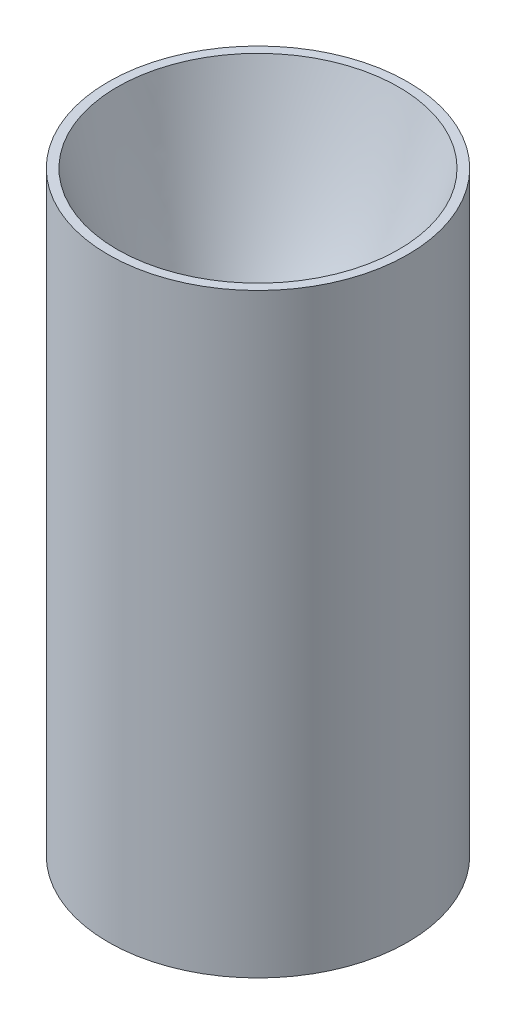
from build123d import *

# Parameters (mm, degrees)
SHORTEN_CHAMBER_75IN_BY = 19.05
CIRPATTERN1_COUNT       = 8


with BuildPart() as part:
    # Sketch1 → Revolve2 (revolve)
    with BuildSketch(Plane.XY):
        with BuildLine():
            Line((71.638455479, 109.927347077), (76.2, 109.927347077))
            Line((76.2, 109.927347077), (76.2, -212.127673725))
            Line((76.2, -212.127673725), (53.792460196, -212.127673725))
            Line((53.792460196, -212.127673725), (53.792460196, -59.727673725))
            add(Edge.make_bspline(
                [(53.792460196, -59.727673725), (53.792458964, -59.657143655), (53.791929819, -59.515566601), (53.789553965, -59.181725115), (53.783229362, -58.904955991), (53.77374387, -58.532727986), (53.761100968, -58.21299812), (53.741350135, -57.781754942), (53.711337787, -57.281120398), (53.667125616, -56.688158665), (53.588220936, -55.848640867), (53.488359334, -55.008326363), (53.367608248, -54.172595934), (53.197743271, -53.172585746), (53.002996623, -52.17760333), (52.777307543, -51.188699595), (52.520946634, -50.207649553), (52.240221737, -49.233238259), (51.935281123, -48.266129746), (51.5444702, -47.149295595), (51.050452714, -45.89056894), (50.509666089, -44.651129345), (49.922993248, -43.432862075), (49.291052535, -42.237253796), (48.615057518, -41.066315445), (47.895407794, -39.921133233), (47.134034398, -38.804236825), (46.430801308, -37.85161238), (45.804470174, -37.055832726), (45.263749909, -36.403541893), (44.82605917, -35.894408249), (44.425708405, -35.447153279), (44.092389714, -35.084791811), (43.784856831, -34.760500781), (43.58500461, -34.551710083), (43.355324273, -34.318676923), (43.254715351, -34.217322692), (43.204843203, -34.167450306)],
                knots=[0.082637729, 0.082637729, 0.082637729, 0.082637729, 0.082637729, 0.092574926, 0.102512123, 0.11244932, 0.122386517, 0.132323714, 0.142260911, 0.162135305, 0.182009699, 0.201884093, 0.24163288, 0.261507274, 0.281381668, 0.321130456, 0.360879243, 0.380753637, 0.400628031, 0.440376819, 0.480125606, 0.519874394, 0.559623181, 0.599371969, 0.639120757, 0.678869544, 0.718618332, 0.75836712, 0.798115907, 0.817990301, 0.837864695, 0.857739089, 0.877613483, 0.88755068, 0.897487877, 0.907425074, 0.91736227, 0.91736227, 0.91736227, 0.91736227, 0.91736227], degree=4))
            Line((43.204843203, -34.167450306), (34.597215006, -25.55982211))
            add(Edge.make_bspline(
                [(24.01, 0), (24.010001231, -0.070528647), (24.010530378, -0.21358419), (24.012906064, -0.543182916), (24.019230459, -0.824160397), (24.028715581, -1.194822072), (24.041357875, -1.513435058), (24.0571581, -1.861939603), (24.076113359, -2.193706872), (24.103750974, -2.6180694), (24.143219182, -3.122033947), (24.214231845, -3.879978675), (24.334058818, -4.886450388), (24.510418188, -6.05671076), (24.761817381, -7.385166414), (25.062727465, -8.703574514), (25.412702779, -10.009637208), (25.811293143, -11.301819595), (26.257877555, -12.578099333), (26.75193549, -13.836887482), (27.292605293, -15.076197126), (27.879411561, -16.294609791), (28.511071576, -17.489938791), (29.187464578, -18.661287753), (29.906377287, -19.805743392), (30.668954188, -20.92386007), (31.370099384, -21.874411755), (31.999668317, -22.673445475), (32.535060612, -23.320422132), (32.983187966, -23.84000501), (33.419382225, -24.32981624), (33.846758322, -24.788484383), (34.156490841, -25.113868303), (34.44779216, -25.409649039), (34.547344628, -25.509949925), (34.597215006, -25.55982211)],
                knots=[0.082637729, 0.082637729, 0.082637729, 0.082637729, 0.082637729, 0.092574926, 0.102512123, 0.11244932, 0.122386517, 0.132323714, 0.142260911, 0.152198108, 0.162135305, 0.182009699, 0.201884093, 0.24163288, 0.281381668, 0.321130456, 0.360879243, 0.400628031, 0.440376819, 0.480125606, 0.519874394, 0.559623181, 0.599371969, 0.639120757, 0.678869544, 0.718618332, 0.75836712, 0.798115907, 0.817990301, 0.837864695, 0.857739089, 0.877613483, 0.897487877, 0.907425074, 0.91736227, 0.91736227, 0.91736227, 0.91736227, 0.91736227], degree=4))
            add(Edge.make_bspline(
                [(24.01, 0), (24.010000626, 0.035892652), (24.010538457, 0.11011369), (24.012955849, 0.267641069), (24.019393694, 0.427064117), (24.031465725, 0.646764266), (24.052367213, 0.901433328), (24.086116845, 1.202537273), (24.137431431, 1.542050498), (24.201475827, 1.880996777), (24.278073727, 2.21635442), (24.367255697, 2.549239421), (24.468673539, 2.878092645), (24.582551197, 3.203347041), (24.708128897, 3.523627157), (24.846218103, 3.839666733), (24.995002427, 4.149282184), (25.156944348, 4.454783123), (25.327420631, 4.751301575), (25.513446847, 5.045703861), (25.702720396, 5.325518936), (25.9153376, 5.610727543), (26.0898085, 5.832913647), (26.277277882, 6.049951637), (26.415487374, 6.208641646), (26.581374196, 6.382121779), (26.655452387, 6.458478841), (26.706211329, 6.50923965)],
                knots=[0.082568816, 0.082568816, 0.082568816, 0.082568816, 0.082568816, 0.102426634, 0.122284453, 0.142142271, 0.162000089, 0.201715725, 0.241431362, 0.281146998, 0.320862634, 0.360578271, 0.400293907, 0.440009544, 0.47972518, 0.519440816, 0.559156453, 0.598872089, 0.638587725, 0.678303362, 0.718018998, 0.757734635, 0.797450271, 0.837165907, 0.857023726, 0.876881544, 0.91659718, 0.91659718, 0.91659718, 0.91659718, 0.91659718], degree=4))
            add(Edge.make_bspline(
                [(26.706211329, 6.50923965), (49.172333461, 34.635954224), (71.638455479, 109.927347077)],
                knots=[0, 0, 0, 1, 1, 1], degree=2))
        make_face()
    revolve(axis=Axis((0, 0, 0), (0, -1, 0)))

    # shorten_chamber_.75in: a face moved inward by 19.05
    extrude(part.faces().sort_by_distance((0, -212.127673725, -60.96))[0], amount=SHORTEN_CHAMBER_75IN_BY, dir=(0, 1, 0), mode=Mode.SUBTRACT)

    # Sketch4 → 3/8-24 Tapped Hole1 (revolve, cut)
    with BuildSketch(Plane(origin=(66.675, -193.077673725, 0), x_dir=(0, 0, -1), z_dir=(1, 0, 0))):
        Polygon((0, 0), (0, 27.534688714), (4.2164, 25.00122), (4.2164, 0), align=None)
    f_3_8_24_tapped_hole1 = revolve(axis=Axis((66.675, -199.427673725, 0), (0, 1, 0)), mode=Mode.SUBTRACT)

    # CirPattern1: 3/8-24 Tapped Hole1 ×8 about axis
    cirpattern1_axis = Axis((0, -193.077673725, 0), (0, 1, 0))
    for i in range(1, CIRPATTERN1_COUNT):
        add(f_3_8_24_tapped_hole1.rotate(cirpattern1_axis, i * 360 / CIRPATTERN1_COUNT), mode=Mode.SUBTRACT)


solid = part.part
